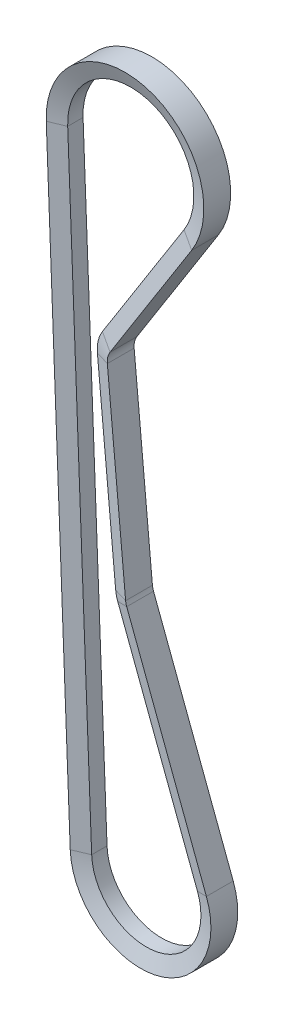
from build123d import *


with BuildPart() as part:
    # Sweep1: sweep along a path in Sketch2
    with BuildLine(Plane.XY) as sweep1_path:
        Line((-24.981259666, -0.9678148), (-33.497238023, 218.8468301))
        ThreePointArc((-33.497238023, 218.8468301), (1.753137189, 246.970147683), (18.143318794, 204.959769306))
        Line((18.143318794, 204.959769306), (-10.843852299, 159.145817707))
        ThreePointArc((-10.843852299, 159.145817707), (-11.652336003, 157.232836689), (-11.800348242, 155.161307146))
        Line((-11.800348242, 155.161307146), (-5.3041432, 85.463392399))
        ThreePointArc((-5.3041432, 85.463392399), (-5.168666149, 84.623687049), (-4.922180902, 83.809620633))
        Line((-4.922180902, 83.809620633), (23.388323832, 8.830985695))
        ThreePointArc((23.388323832, 8.830985695), (4.963716745, -24.502275733), (-24.981259666, -0.9678148))
    # Sketch3 → Sweep1 (sweep)
    with BuildSketch(Plane(origin=(23.388323832, 8.830985695, 0), x_dir=(-0.9355329532710762, -0.35323942778786516, 0), z_dir=(0.35323942778786516, -0.9355329532710762, 0))):
        Polygon((0, -4.7625), (0, 4.7625), (5.588, 2.728634331), (5.588, -2.728634331), align=None)
    sweep(path=sweep1_path.line)


solid = part.part
